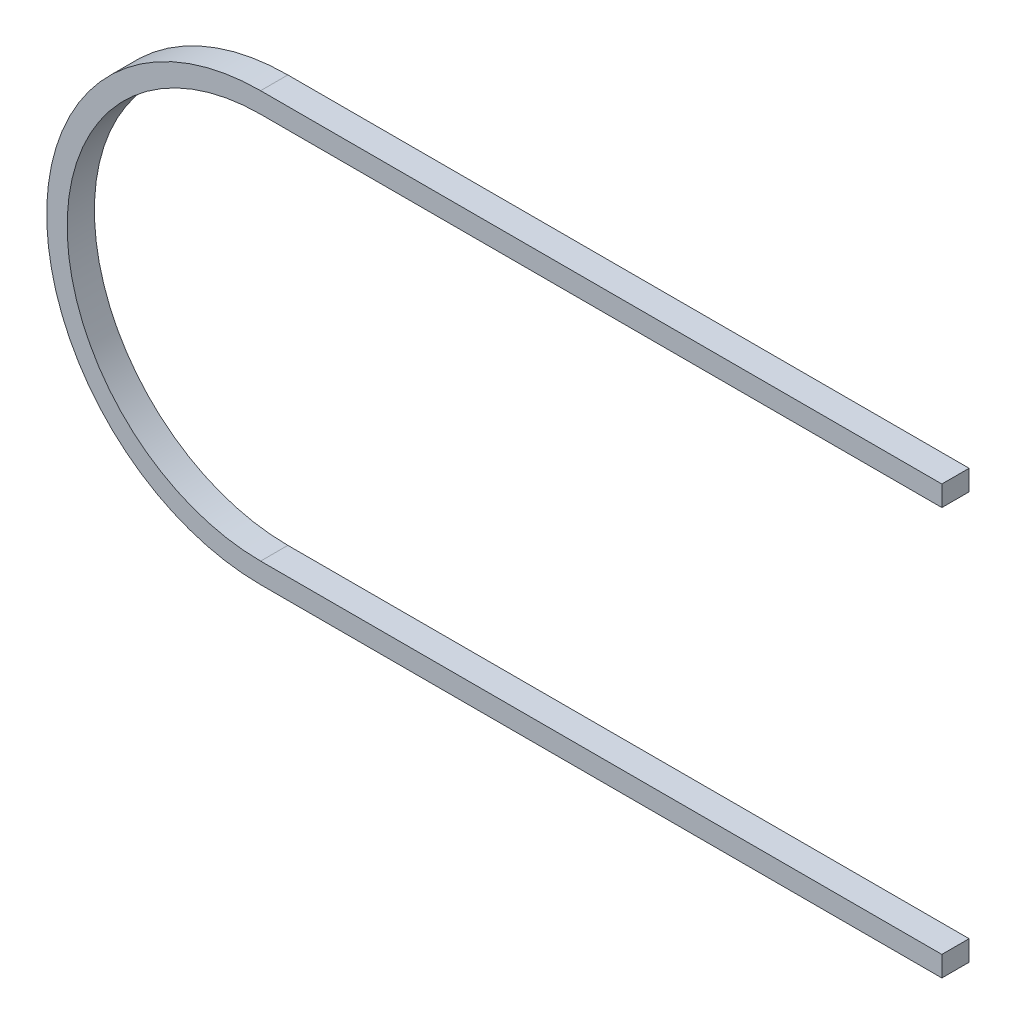
from build123d import *

# Parameters (mm, degrees)
BOSS_EXTRUDE1_DEPTH = 2.54


with BuildPart() as part:
    # Sketch1 → Boss-Extrude1 (new body)
    with BuildSketch(Plane.XY):
        with BuildLine():
            Line((0, 19.939), (63.5, 19.939))
            Line((63.5, 19.939), (63.5, 18.034))
            Line((63.5, 18.034), (0, 18.034))
            ThreePointArc((0, 18.034), (-18.034, 0), (0, -18.034))
            Line((0, -18.034), (63.5, -18.034))
            Line((63.5, -18.034), (63.5, -19.939))
            Line((63.5, -19.939), (0, -19.939))
            ThreePointArc((0, -19.939), (-19.939, 0), (0, 19.939))
        make_face()
    extrude(amount=BOSS_EXTRUDE1_DEPTH)


solid = part.part
